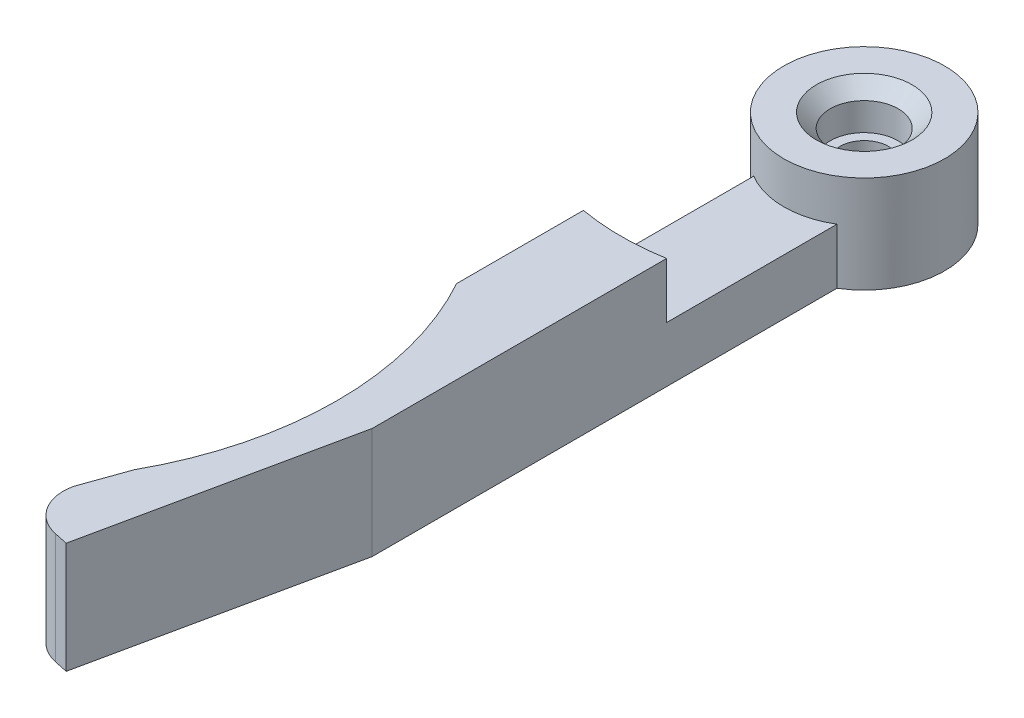
from build123d import *
from build123d.topology import SkipClean

# Parameters (mm, degrees)
BOSS_EXTRU_1_DEPTH             = 8
ESQUISSE2_R                    = 2.45
ENL_V_MAT_EXTRU_1_DEPTH        = 4
ENL_V_MAT_EXTRU_2_REACH        = 59.094
ESQUISSE3_R                    = 1.75
ESQUISSE4_R                    = 3.75
ENL_V_MAT_EXTRU_3_DEPTH        = 2.5
ENL_V_START                    = -4
ENL_V_MAT_EXTRU_4_DEPTH        = 4
CORPS_D_PLACER_COPIER1_DEPTH   = 8
CORPS_D_PLACER_COPIER1_2_DEPTH = 8
CORPS_D_PLACER_COPIER1_3_DEPTH = 4
ENL_V_START_2                  = -1
ESQUISSE6_R                    = 5.8
ENL_V_MAT_EXTRU_5_DEPTH        = 1
CHANFREIN1_SIZE                = 1


# Read off the part's stored shape, not the designer's step: Corps-Déplacer/Copier1
with BuildPart() as part:
    # Esquisse1 → Boss.-Extru.1 (new body)
    with BuildSketch(Plane(origin=(0, 0, 0), x_dir=(1, 0, 0), z_dir=(0, 1, 0))):
        with BuildLine():
            Line((-3, 26.381049961), (-3, 4.963869458))
            ThreePointArc((-3, 4.963869458), (0, -5.8), (3, 4.963869458))
            Line((3, 4.963869458), (3, 38.463869458))
            Line((3, 38.463869458), (-0.867157449, 56.657414832))
            Line((-0.867157449, 56.657414832), (-1.84530505, 56.449503141))
            ThreePointArc((-1.84530505, 56.449503141), (-3.756758837, 55.119060789), (-4.140414176, 52.821988519))
            Line((-4.140414176, 52.821988519), (-3, 49.618950039))
            ThreePointArc((-3, 49.618950039), (0, 38), (-3, 26.381049961))
        make_face()
    extrude(amount=BOSS_EXTRU_1_DEPTH)

    # Esquisse2 → Enlèv. mat.-Extru.1 (cut)
    with BuildSketch(Plane(origin=(0, 8, 0), x_dir=(1, 0, 0), z_dir=(0, 1, 0))):
        with Locations(Location((0, 0, 0), (0, 0, 270))):
            Circle(ESQUISSE2_R)
    extrude(amount=-ENL_V_MAT_EXTRU_1_DEPTH, mode=Mode.SUBTRACT)

    # Esquisse3 → Enlèv. mat.-Extru.2 (cut, up to next)
    with BuildSketch(Plane(origin=(0, 4, 0), x_dir=(1, 0, 0), z_dir=(0, 1, 0)), mode=Mode.PRIVATE) as enl_v_mat_extru_2_sk1:
        with Locations(Location((0, 0, 0), (0, 0, 270))):
            Circle(ESQUISSE3_R)
    enl_v_mat_extru_2_tool1 = extrude(enl_v_mat_extru_2_sk1.sketch, amount=-ENL_V_MAT_EXTRU_2_REACH, mode=Mode.PRIVATE) & part.part
    add(enl_v_mat_extru_2_tool1.solids().sort_by_distance((0, 4, 0))[0], mode=Mode.SUBTRACT)

    # Esquisse4 → Enlèv. mat.-Extru.3 (cut)
    with BuildSketch(Plane.XZ):
        with Locations(Location((0, 0, 0), (0, 0, 270))):
            Circle(ESQUISSE4_R)
    extrude(amount=-ENL_V_MAT_EXTRU_3_DEPTH, mode=Mode.SUBTRACT)

    # Esquisse5 → Enlèv. mat.-Extru.4 (cut)
    with BuildSketch(Plane(origin=(0, 8, 0), x_dir=(1, 0, 0), z_dir=(0, 1, 0)).offset(ENL_V_START)):
        with BuildLine():
            Line((-3, 4.963869458), (-3, 17.24093965))
            ThreePointArc((-3, 17.24093965), (0, 17.5), (3, 17.24093965))
            Line((3, 17.24093965), (3, 4.963869458))
            ThreePointArc((3, 4.963869458), (0, 5.8), (-3, 4.963869458))
        make_face()
    extrude(amount=ENL_V_MAT_EXTRU_4_DEPTH, mode=Mode.SUBTRACT)

    # Corps-Déplacer/Copier1 outline → Corps-Déplacer/Copier1 (cut)
    with SkipClean():  # the faces are left unmerged after this step: merging them gives an invalid solid
        with BuildSketch(Plane(origin=(0, 0, 0), x_dir=(1, 0, 0), z_dir=(0, 1, 0))):
            with BuildLine():
                ThreePointArc((-3, 4.963869458), (0, 5.8), (3, 4.963869458))
                Line((3, 4.963869458), (3, 38.463869458))
                Line((3, 38.463869458), (-0.867157449, 56.657414832))
                Line((-0.867157449, 56.657414832), (-1.84530505, 56.449503141))
                ThreePointArc((-1.84530505, 56.449503141), (-3.756758837, 55.119060789), (-4.140414176, 52.821988519))
                Line((-4.140414176, 52.821988519), (-3, 49.618950039))
                ThreePointArc((-3, 49.618950039), (0, 38), (-3, 26.381049961))
                Line((-3, 26.381049961), (-3, 4.963869458))
            make_face()
        extrude(amount=CORPS_D_PLACER_COPIER1_DEPTH, mode=Mode.SUBTRACT)



with BuildPart() as body_2:
    # Corps-D_placer_Copier1 2 outline → Corps-D_placer_Copier1 2 (new body)
    with BuildSketch(Plane(origin=(0, 0, 0), x_dir=(1, 0, 0), z_dir=(0, 1, 0))):
        with BuildLine():
            Line((3, -38.463869458), (3, -17.24093965))
            ThreePointArc((3, -17.24093965), (0, -17.5), (-3, -17.24093965))
            Line((-3, -17.24093965), (-3, -26.381049961))
            ThreePointArc((-3, -26.381049961), (0, -38), (-3, -49.618950039))
            Line((-3, -49.618950039), (-4.140414176, -52.821988519))
            ThreePointArc((-4.140414176, -52.821988519), (-3.756758837, -55.119060789), (-1.84530505, -56.449503141))
            Line((-1.84530505, -56.449503141), (-0.867157449, -56.657414832))
            Line((-0.867157449, -56.657414832), (3, -38.463869458))
        make_face()
    extrude(amount=CORPS_D_PLACER_COPIER1_2_DEPTH)


with BuildPart() as part_1:
    with SkipClean():  # the faces are left unmerged after this step: merging them gives an invalid solid
        add(part.part)

        add(body_2.part)  # Corps-D_placer_Copier1 3 merges body 2
        # Corps-D_placer_Copier1 3 outline → Corps-D_placer_Copier1 3 (add)
        with BuildSketch(Plane(origin=(0, 0, 0), x_dir=(1, 0, 0), z_dir=(0, 1, 0))):
            with BuildLine():
                Line((3, -17.24093965), (3, -4.963869458))
                ThreePointArc((3, -4.963869458), (0, -5.8), (-3, -4.963869458))
                Line((-3, -4.963869458), (-3, -17.24093965))
                ThreePointArc((-3, -17.24093965), (0, -17.5), (3, -17.24093965))
            make_face()
        extrude(amount=CORPS_D_PLACER_COPIER1_3_DEPTH)

    # Esquisse6 → Enlèv. mat.-Extru.5 (cut)
    with BuildSketch(Plane(origin=(0, 8, 0), x_dir=(1, 0, 0), z_dir=(0, 1, 0)).offset(ENL_V_START_2)):
        with Locations(Location((0, 0, 0), (0, 0, 270))):
            Circle(ESQUISSE6_R)
    extrude(amount=ENL_V_MAT_EXTRU_5_DEPTH, mode=Mode.SUBTRACT)

    # Chanfrein1
    chanfrein1_edges = [part_1.edges().sort_by_distance(p)[0] for p in [
        (0, 7, -2.45),
    ]]
    chamfer(chanfrein1_edges, length=CHANFREIN1_SIZE)


solid = part_1.part
